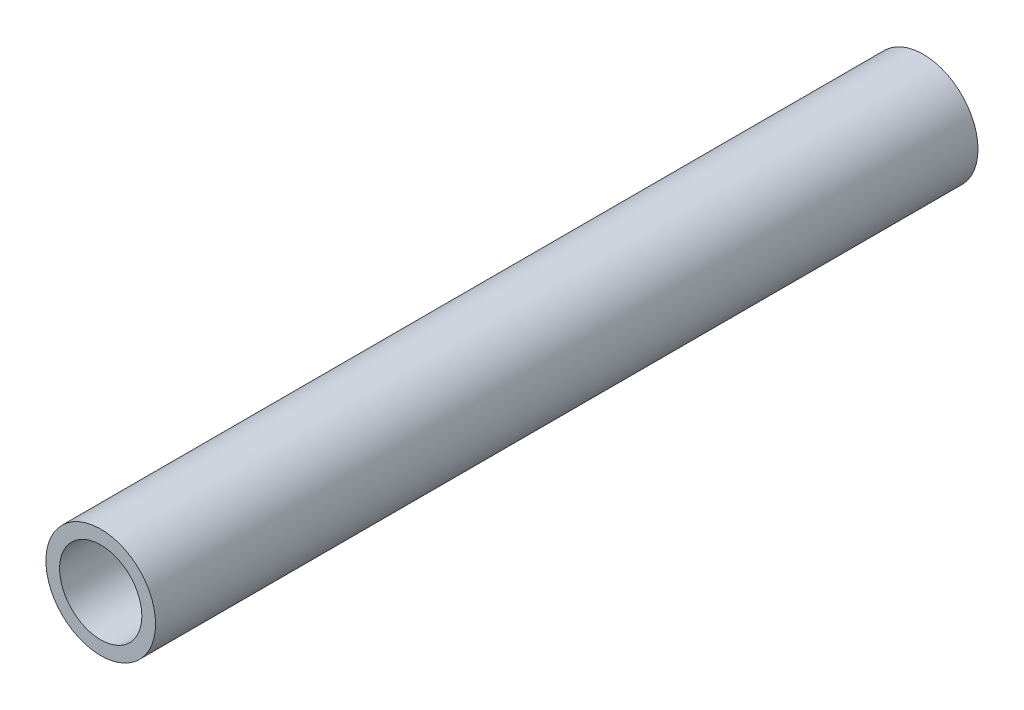
from build123d import *

# Parameters (mm, degrees)
SCHIZZO1_R                   = 80
SCHIZZO1_R_2                 = 60
ESTRUSIONE_ESTRUSIONE1_DEPTH = 1200


with BuildPart() as part:
    # Schizzo1 → Estrusione-Estrusione1 (new body)
    with BuildSketch(Plane.XY):
        Circle(SCHIZZO1_R)
        Circle(SCHIZZO1_R_2, mode=Mode.SUBTRACT)
    extrude(amount=ESTRUSIONE_ESTRUSIONE1_DEPTH)


solid = part.part
